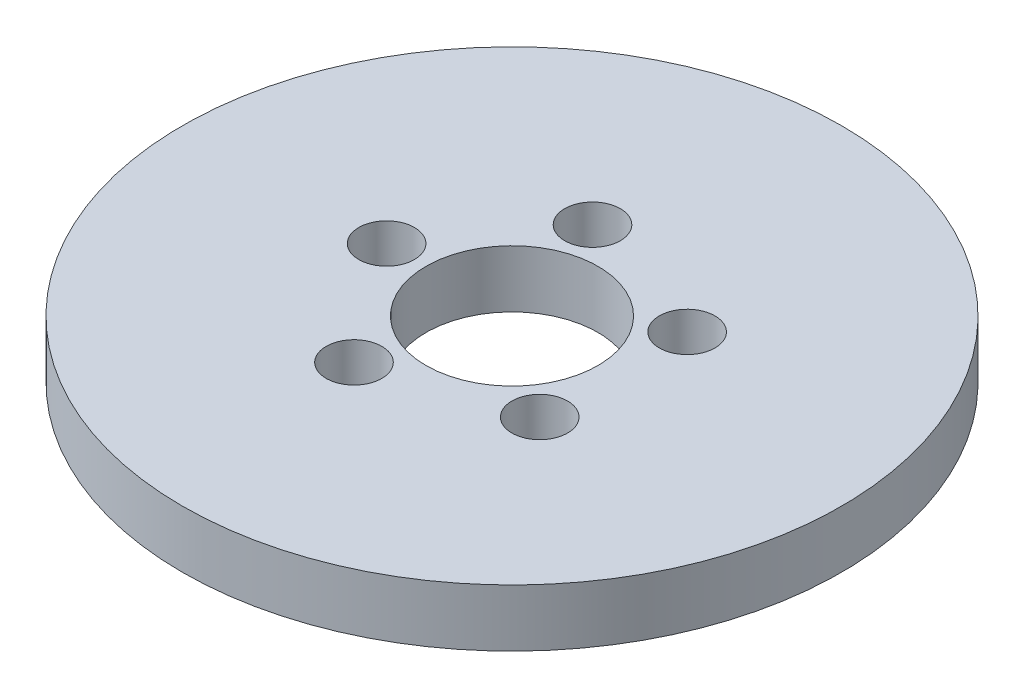
from build123d import *

# Parameters (mm, degrees)
SKETCH1_R           = 57.5
BOSS_EXTRUDE1_DEPTH = 10
SKETCH2_R           = 15
CUT_EXTRUDE1_DEPTH  = 82.929848041
SKETCH3_R           = 4.853203741
CUT_EXTRUDE2_DEPTH  = 9.310224333
CIRPATTERN1_COUNT   = 5


with BuildPart() as part:
    # Sketch1 → Boss-Extrude1 (new body)
    with BuildSketch(Plane(origin=(0, 0, 0), x_dir=(1, 0, 0), z_dir=(0, 1, 0))):
        Circle(SKETCH1_R)
    extrude(amount=BOSS_EXTRUDE1_DEPTH)

    # Sketch2 → Cut-Extrude1 (cut, through all)
    with BuildSketch(Plane(origin=(0, 0, 0), x_dir=(1, 0, 0), z_dir=(0, 1, 0))):
        Circle(SKETCH2_R)
    extrude(amount=CUT_EXTRUDE1_DEPTH, mode=Mode.SUBTRACT)

    # Sketch3 → Cut-Extrude2 (cut)
    with BuildSketch(Plane(origin=(0, 10, 0), x_dir=(1, 0, 0), z_dir=(0, 1, 0))):
        with Locations((-21.87766066, 0)):
            Circle(SKETCH3_R)
    cut_extrude2 = extrude(amount=-CUT_EXTRUDE2_DEPTH, mode=Mode.SUBTRACT)

    # CirPattern1: Cut-Extrude2 ×5 about axis
    cirpattern1_axis = Axis((0, 0, 0), (0, 1, 0))
    for i in range(1, CIRPATTERN1_COUNT):
        add(cut_extrude2.rotate(cirpattern1_axis, i * 360 / CIRPATTERN1_COUNT), mode=Mode.SUBTRACT)


solid = part.part
